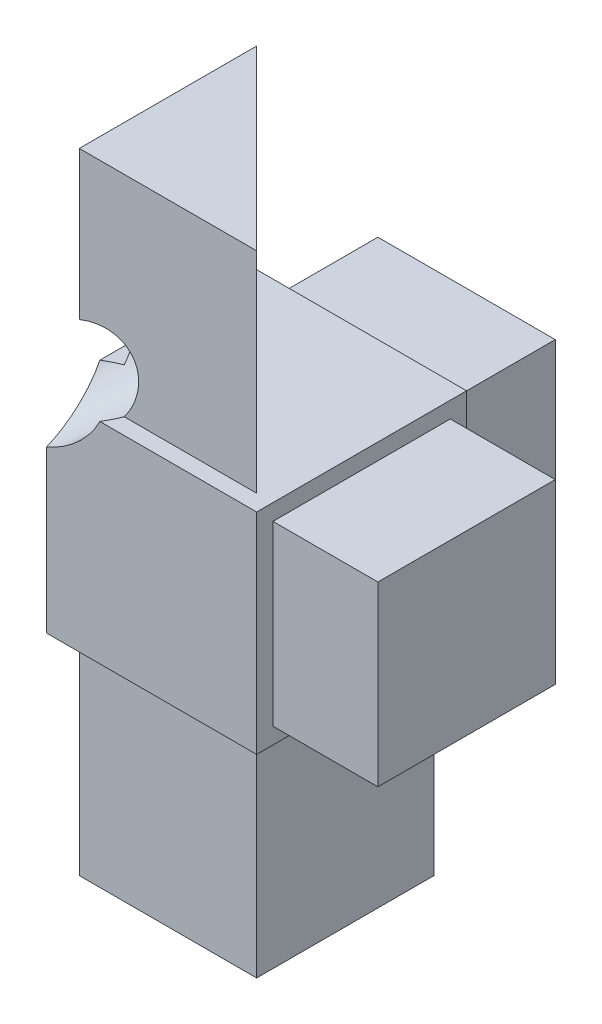
from build123d import *

# Parameters (mm, degrees)
SKETCH1_W           = 20
SKETCH1_H           = 20
BOSS_EXTRUDE1_DEPTH = 20
BOSS_EXTRUDE2_START = 1.55
SKETCH1_3_W         = 10
SKETCH1_3_H         = 16.9
SKETCH1_3_W_2       = 16.9
SKETCH1_3_H_2       = 10
BOSS_EXTRUDE2_DEPTH = 16.9
SKETCH1_4_W         = 16.9
SKETCH1_4_H         = 16.9
BOSS_EXTRUDE3_DEPTH = 20
BOSS_EXTRUDE4_DEPTH = 40
SKETCH2_R           = 4
CUT_EXTRUDE1_DEPTH  = 61.098897979


with BuildPart() as part:
    # Sketch1 → Boss-Extrude1 (new body)
    with BuildSketch(Plane(origin=(0, 0, 0), x_dir=(1, 0, 0), z_dir=(0, 1, 0))):
        Rectangle(SKETCH1_W, SKETCH1_H)
    extrude(amount=BOSS_EXTRUDE1_DEPTH)

    # Sketch1<3> → Boss-Extrude2 (add)
    with BuildSketch(Plane(origin=(0, 0, 0), x_dir=(1, 0, 0), z_dir=(0, 1, 0)).offset(BOSS_EXTRUDE2_START)):
        with Locations((15, 0)):
            Rectangle(SKETCH1_3_W, SKETCH1_3_H)
        with Locations((0, 15)):
            Rectangle(SKETCH1_3_W_2, SKETCH1_3_H_2)
    extrude(amount=BOSS_EXTRUDE2_DEPTH)

    # Sketch1<4> → Boss-Extrude3 (add)
    with BuildSketch(Plane(origin=(0, 0, 0), x_dir=(1, 0, 0), z_dir=(0, 1, 0))):
        Rectangle(SKETCH1_4_W, SKETCH1_4_H)
    extrude(amount=-BOSS_EXTRUDE3_DEPTH)

    # Sketch1<5> → Boss-Extrude4 (add)
    with BuildSketch(Plane(origin=(0, 0, 0), x_dir=(1, 0, 0), z_dir=(0, 1, 0))):
        Polygon((8.45, -8.45), (-8.45, 8.45), (-8.45, -8.45), align=None)
    extrude(amount=BOSS_EXTRUDE4_DEPTH)

    # Sketch2 → Cut-Extrude1 (cut, through all)
    with BuildSketch(Plane(origin=(-7.348469228, -6, 7.348469228), x_dir=(0.7071067811865477, 0, 0.7071067811865475), z_dir=(0.612372435695794, 0.5000000000000011, -0.6123724356957942))):
        with Locations((0, -24.391575888)):
            Circle(SKETCH2_R)
    extrude(amount=CUT_EXTRUDE1_DEPTH, mode=Mode.SUBTRACT)


solid = part.part
